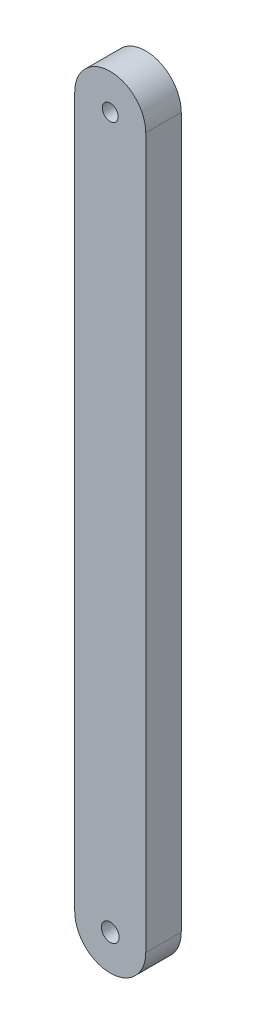
from build123d import *

# Parameters (mm, degrees)
SKETCH1_R             = 2.5
BOSS_EXTRUDE1_DEPTH   = 10
BODY_MOVE_COPY1_ANGLE = 90


with BuildPart() as part:
    # Sketch1 → Boss-Extrude1 (new body)
    with BuildSketch(Plane(origin=(0, 0, 0), x_dir=(1, 0, 0), z_dir=(0, 1, 0))):
        with BuildLine():
            ThreePointArc((-10, -100), (0, -110), (10, -100))
            Line((10, -100), (10, 100))
            ThreePointArc((10, 100), (0, 110), (-10, 100))
            Line((-10, 100), (-10, -100))
        make_face()
        with Locations((0, -100)):
            Circle(SKETCH1_R, mode=Mode.SUBTRACT)
        with BuildLine():
            ThreePointArc((1.5875, 98.4125), (0, 97.75493597), (-1.5875, 98.4125))
            ThreePointArc((-1.5875, 98.4125), (-2.24506403, 100), (-1.5875, 101.5875))
            ThreePointArc((-1.5875, 101.5875), (0, 102.24506403), (1.5875, 101.5875))
            ThreePointArc((1.5875, 101.5875), (2.074168707, 100.859148809), (2.24506403, 100))
            ThreePointArc((2.24506403, 100), (2.074168707, 99.140851191), (1.5875, 98.4125))
        make_face(mode=Mode.SUBTRACT)
    extrude(amount=BOSS_EXTRUDE1_DEPTH)


with BuildPart() as part_1:
    # Body-Move/Copy1: moved
    add(part.part.rotate(Axis((0, 5, 0), (1, 0, 0)), BODY_MOVE_COPY1_ANGLE))


with BuildPart() as part_2:
    # Body-Move/Copy2: moved
    add(part_1.part.moved(Location((0, -105, 0))))


solid = part_2.part
